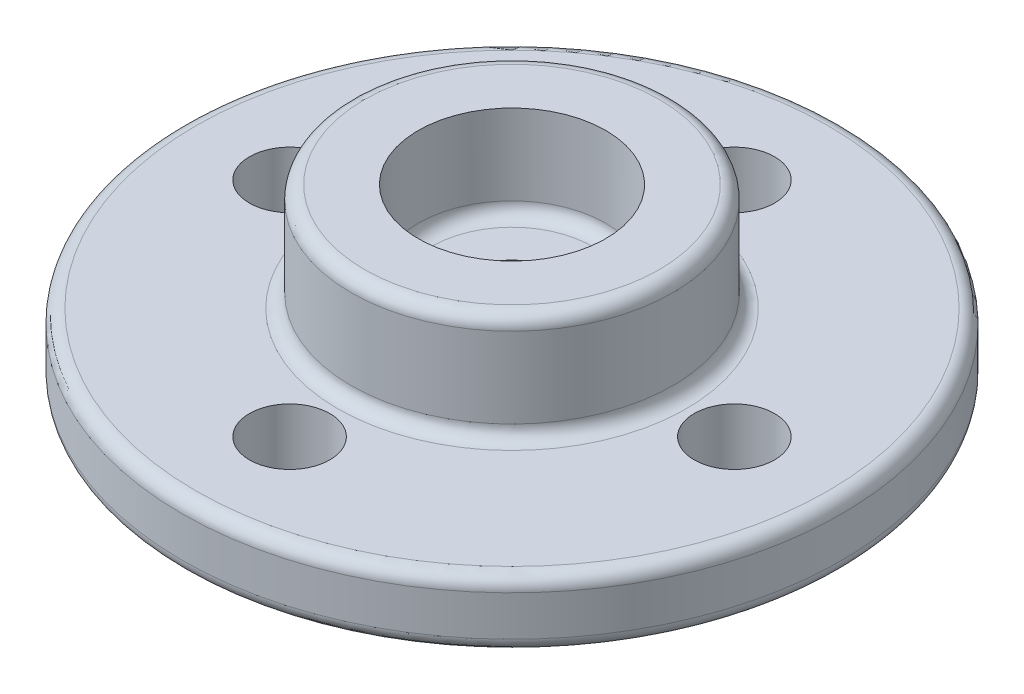
from build123d import *

# Parameters (mm, degrees)
SKETCH2_R          = 1.5
CUT_EXTRUDE1_DEPTH = 10
CIRPATTERN1_COUNT  = 4
FILLET1_R          = 0.5


with BuildPart() as part:
    # Sketch1 → Revolve1 (revolve)
    with BuildSketch(Plane(origin=(0, 0, 0), x_dir=(0, 0, -1), z_dir=(1, 0, 0))):
        Polygon((1.5, 0), (1.5, 3), (3.5, 3), (3.5, 6.5), (6, 6.5), (6, 2.5), (12.3, 2.5), (12.3, 0), align=None)
    revolve(axis=Axis((0, -5.736482489, 0), (0, 1, 0)))

    # Sketch2 → Cut-Extrude1 (cut)
    with BuildSketch(Plane.XZ):
        with Locations((0, -8.3)):
            Circle(SKETCH2_R)
    cut_extrude1 = extrude(amount=-CUT_EXTRUDE1_DEPTH, mode=Mode.SUBTRACT)

    # CirPattern1: Cut-Extrude1 ×4 about axis
    cirpattern1_axis = Axis((0, -5.736482489, 0), (0, -1, 0))
    for i in range(1, CIRPATTERN1_COUNT):
        add(cut_extrude1.rotate(cirpattern1_axis, i * 360 / CIRPATTERN1_COUNT), mode=Mode.SUBTRACT)

    # Fillet1
    fillet1_edges = [part.edges().sort_by_distance(p)[0] for p in [
        (0, 0, 12.3),
        (0, 2.5, 12.3),
        (0, 6.5, 6),
        (0, 3, 3.5),
        (0, 2.5, 6),
    ]]
    fillet(fillet1_edges, radius=FILLET1_R)


solid = part.part
